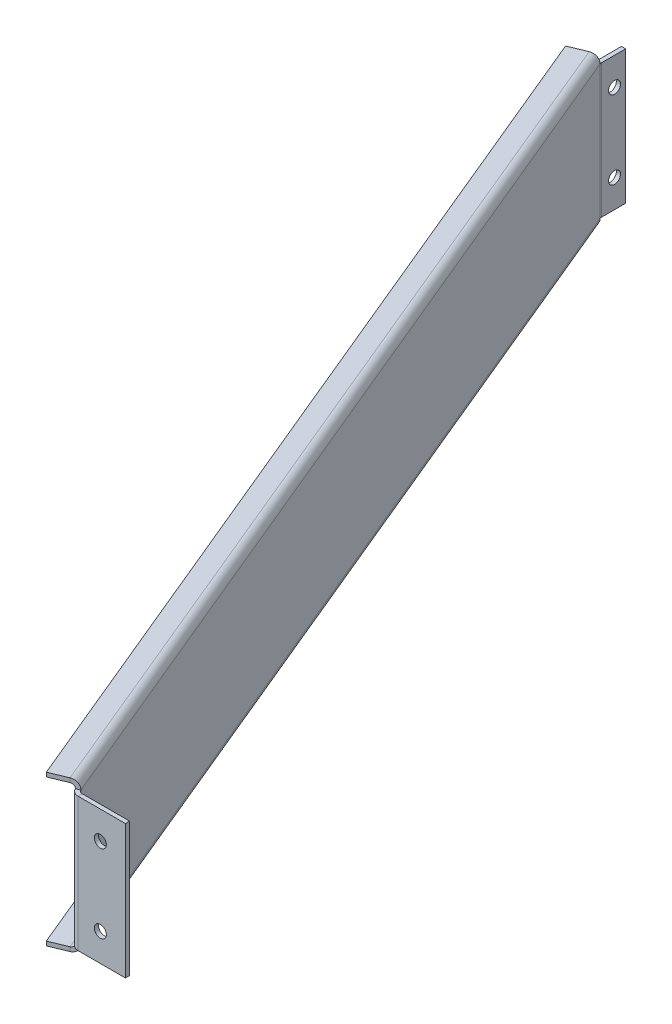
from build123d import *

# Parameters (mm, degrees)
SM_BASE_FLANGE_1_DEPTH      = 24
SM_EDGE_FLANGE_1_DEPTH      = 345.238328462
SM_EDGE_FLANGE_1_BEND_DEPTH = 345.238328462
HOLE_WIZARD_M4_3_D          = 4.3
HOLE_WIZARD_M4_4_D          = 4.3


# Sheet-metal steps are written as plain solids
with BuildPart() as part:
    # Sketch 1 → 基体-法兰1 (new, symmetric)
    with BuildSketch(Plane(origin=(0, 0, 0), x_dir=(1, 0, 0), z_dir=(0, 1, 0))):
        with BuildLine():
            Line((63, 329), (63, 320.299307498))
            ThreePointArc((63, 320.299307498), (63.028998532, 320.005786319), (63.11487291, 319.723614051))
            Line((63.11487291, 319.723614051), (195.615835089, 0.924306553))
            ThreePointArc((195.615835089, 0.924306553), (196.168357882, 0.252294071), (197.000962179, 0))
            Line((197.000962179, 0), (214, 0))
            Line((214, 0), (214, -1.5))
            Line((214, -1.5), (197.000962179, -1.5))
            ThreePointArc((197.000962179, -1.5), (195.335753585, -0.995411858), (194.230707999, 0.348613106))
            Line((194.230707999, 0.348613106), (61.72974582, 319.147920604))
            ThreePointArc((61.72974582, 319.147920604), (61.557997065, 319.71226514), (61.5, 320.299307498))
            Line((61.5, 320.299307498), (61.5, 329))
            Line((61.5, 329), (63, 329))
        make_face()
    extrude(amount=SM_BASE_FLANGE_1_DEPTH, both=True)

    # 边线-法兰1 section (across the edge) → 边线-法兰1 (add)
    with BuildSketch(Plane(origin=(194.230707999, 25.5, -0.348613106), x_dir=(0, -1, 0), z_dir=(-0.3837956311773727, 0, -0.9234180599756332))):
        with BuildLine():
            Line((-1.5, 1.5), (-1.5, 8))
            Line((-1.5, 8), (0, 8))
            Line((0, 8), (0, 1.5))
            ThreePointArc((0, 1.5), (0.439339828, 0.439339828), (1.5, 0))
            Line((1.5, 0), (1.5, -1.5))
            ThreePointArc((1.5, -1.5), (-0.621320344, -0.621320344), (-1.5, 1.5))
        make_face()
    extrude(amount=SM_EDGE_FLANGE_1_DEPTH)

    # 边线-法兰1 section 2 (across the edge) → 边线-法兰1 bend (add)
    with BuildSketch(Plane(origin=(61.72974582, -25.5, -319.147920604), x_dir=(0, 1, 0), z_dir=(0.3837956311773727, 0, 0.9234180599756332))):
        with BuildLine():
            Line((-1.5, 1.5), (-1.5, 8))
            Line((-1.5, 8), (0, 8))
            Line((0, 8), (0, 1.5))
            ThreePointArc((0, 1.5), (0.439339828, 0.439339828), (1.5, 0))
            Line((1.5, 0), (1.5, -1.5))
            ThreePointArc((1.5, -1.5), (-0.621320344, -0.621320344), (-1.5, 1.5))
        make_face()
    extrude(amount=SM_EDGE_FLANGE_1_BEND_DEPTH)

    # M4 间隙槽口3 (through all)
    with Locations(Plane(origin=(63, 0, 0), x_dir=(0, 0, -1), z_dir=(1, 0, 0))):
        with Locations((325, 14), (325, -14)):
            Hole(HOLE_WIZARD_M4_3_D / 2)

    # M4 间隙槽口4 (through all)
    with Locations(Plane(origin=(0, 0, 0), x_dir=(-1, 0, 0), z_dir=(0, 0, -1))):
        with Locations((-205, 14), (-205, -14)):
            Hole(HOLE_WIZARD_M4_4_D / 2)


solid = part.part
